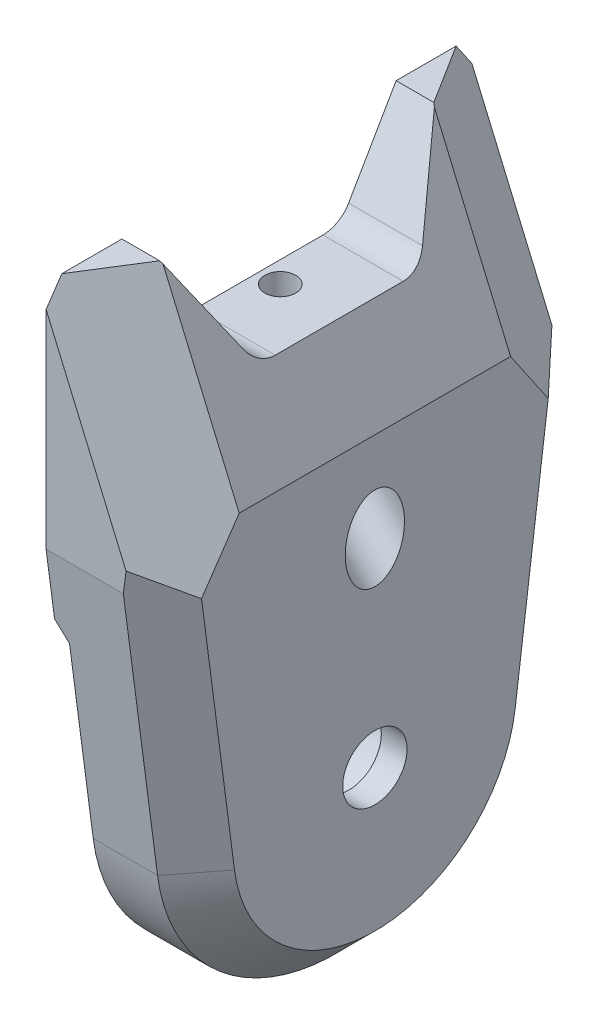
from build123d import *

# Parameters (mm, degrees)
BOSS_EXTRUDE4_DEPTH  = 4.5
SKETCH1_R            = 2.25
BOSS_EXTRUDE1_DEPTH  = 4
SKETCH1_4_R          = 2.25
SKETCH1_4_R_2        = 1.25
BOSS_EXTRUDE2_DEPTH  = 1
CHAMFER1_SIZE        = 3
CHAMFER1_SIZE_2      = 5.196152423
FILLET1_R            = 1.15
CHAMFER2_SIZE        = 7
CHAMFER2_SIZE2       = 3
CHAMFER3_SIZE        = 3
CHAMFER3_SIZE2       = 1.732050808
CHAMFER4_SIZE        = 1.5
CUT_EXTRUDE1_START   = -2
SKETCH1_6_R          = 1.05
CUT_EXTRUDE1_DEPTH   = 19.48660355
CUT_SWEEP1_PROFILE_R = 0.6
CUT_SWEEP2_PROFILE_R = 1.15
CHAMFER5_SIZE        = 0.5


# Some blends are built 0.0001 mm under size
with BuildPart() as part:
    # Sketch1<7> → Boss-Extrude4 (new body)
    with BuildSketch(Plane(origin=(0, 0, 0), x_dir=(0, 0, -1), z_dir=(1, 0, 0))):
        with BuildLine():
            Line((8.27, 9.234757272), (8.27, 18.195))
            Line((8.27, 18.195), (2.325, 18.195))
            Line((2.325, 18.195), (2.325, 14.425))
            Line((2.325, 14.425), (-2.325, 14.425))
            Line((-2.325, 14.425), (-2.325, 18.195))
            Line((-2.325, 18.195), (-8.27, 18.195))
            Line((-8.27, 18.195), (-8.27, 9.234757272))
            Line((-8.27, 9.234757272), (-7.859471067, 6.101983066))
            Line((-7.859471067, 6.101983066), (-5.358442733, 4.658013684))
            ThreePointArc((-5.358442733, 4.658013684), (0, 7.1), (5.358442733, 4.658013684))
            Line((5.358442733, 4.658013684), (7.859471067, 6.101983066))
            Line((7.859471067, 6.101983066), (8.27, 9.234757272))
        make_face()
    extrude(amount=-BOSS_EXTRUDE4_DEPTH)

    # Sketch1 → Boss-Extrude1 (add)
    with BuildSketch(Plane(origin=(0, 0, 0), x_dir=(0, 0, -1), z_dir=(1, 0, 0))):
        with BuildLine():
            Line((6.940659998, -0.909526687), (7.859471067, 6.101983066))
            Line((7.859471067, 6.101983066), (5.358442733, 4.658013684))
            ThreePointArc((5.358442733, 4.658013684), (0, 7.1), (-5.358442733, 4.658013684))
            Line((-5.358442733, 4.658013684), (-7.859471067, 6.101983066))
            Line((-7.859471067, 6.101983066), (-6.940659998, -0.909526687))
            ThreePointArc((-6.940659998, -0.909526687), (0, -7), (6.940659998, -0.909526687))
        make_face()
        Circle(SKETCH1_R, mode=Mode.SUBTRACT)
    extrude(amount=-BOSS_EXTRUDE1_DEPTH)

    # Sketch1<4> → Boss-Extrude2 (add)
    with BuildSketch(Plane(origin=(0, 0, 0), x_dir=(0, 0, -1), z_dir=(1, 0, 0))):
        Circle(SKETCH1_4_R)
        Circle(SKETCH1_4_R_2, mode=Mode.SUBTRACT)
    extrude(amount=-BOSS_EXTRUDE2_DEPTH)

    # Chamfer1
    # the kernel refuses this chamfer: 5.196152423, 3 mm, written as the material it takes off along each edge
    with BuildSketch(Plane(origin=(13.442891912, 18.195, -2.325), x_dir=(0, 0.057893862402672046, -0.9983227437537926), z_dir=(-1, 0, 0))) as chamfer1_piece_1_section:
        Polygon((CHAMFER1_SIZE * 0.998322743754, CHAMFER1_SIZE * 0.0578938624027), (-CHAMFER1_SIZE_2 * 0.0578938623994, CHAMFER1_SIZE_2 * 0.998322743697), (0, 0), align=None)
    chamfer1_piece_1 = extrude(amount=31.385783824, mode=Mode.PRIVATE)
    chamfer1_piece_1 = split(chamfer1_piece_1, bisect_by=Plane(origin=(-2.25, 14.425, -3.37149022), z_dir=(0, 1, 0)), keep=Keep.TOP, mode=Mode.PRIVATE)
    add(chamfer1_piece_1, mode=Mode.SUBTRACT)
    with BuildSketch(Plane(origin=(13.442891912, 18.195, 2.325), x_dir=(0, -0.9998132206222079, -0.019326765612700594), z_dir=(-1, 0, 0))) as chamfer1_piece_2_section:
        Polygon((CHAMFER1_SIZE_2 * 0.999813220566, CHAMFER1_SIZE_2 * 0.0193267656116), (-CHAMFER1_SIZE * 0.0193267656127, CHAMFER1_SIZE * 0.999813220622), (0, 0), align=None)
    chamfer1_piece_2 = extrude(amount=31.385783824, mode=Mode.PRIVATE)
    chamfer1_piece_2 = split(chamfer1_piece_2, bisect_by=Plane(origin=(-2.25, 14.425, 3.37149022), z_dir=(0, 1, 0)), keep=Keep.TOP, mode=Mode.PRIVATE)
    add(chamfer1_piece_2, mode=Mode.SUBTRACT)

    # Fillet1
    fillet1_edges = [part.edges().sort_by_distance(p)[0] for p in [
        (-2.25, 14.425, -3.148389485),
        (-2.25, 14.425, 3.148389485),
    ]]
    fillet(fillet1_edges, radius=FILLET1_R)

    # Chamfer2
    chamfer2_edges = [part.edges().sort_by_distance(p)[0] for p in [
        (0, 18.195, 6.7975),
    ]]
    chamfer2_side = [part.faces().sort_by_distance(p)[0] for p in [
        (0, 5.909970068, 0),
    ]]
    chamfer(chamfer2_edges, length=CHAMFER2_SIZE, length2=CHAMFER2_SIZE2, reference=chamfer2_side[0])

    # Chamfer3
    chamfer3_edges = [part.edges().sort_by_distance(p)[0] for p in [
        (-1.5, 14.695, -8.27),
        (-1.5, 14.695, 8.27),
    ]]
    chamfer3_side = [part.faces().sort_by_distance(p)[0] for p in [
        (-1.210290333, 14.019010778, 0),
    ]]
    chamfer(chamfer3_edges, length=CHAMFER3_SIZE, length2=CHAMFER3_SIZE2, reference=chamfer3_side[0])

    # Chamfer4
    chamfer4_edges = [part.edges().sort_by_distance(p)[0] for p in [
        (0, 3.140553901, 7.471395746),
        (0, 3.140553901, -7.471395746),
        (0, -7, 0),
    ]]
    chamfer(chamfer4_edges, length=CHAMFER4_SIZE)

    # Sketch1<6> → Cut-Extrude1 (cut, through all)
    with BuildSketch(Plane(origin=(0, 0, 0), x_dir=(0, 0, -1), z_dir=(1, 0, 0)).offset(CUT_EXTRUDE1_START)):
        with Locations((6.25, 11.925)):
            Circle(SKETCH1_6_R)
        with Locations((-6.25, 11.925)):
            Circle(SKETCH1_6_R)
    extrude(amount=-CUT_EXTRUDE1_DEPTH, mode=Mode.SUBTRACT)

    # Cut-Sweep1: sweep along a path in Sketch2
    with BuildLine(Plane.XY) as cut_sweep1_path:
        Line((4.128300859, 3.586165235), (-2.942766953, 10.657233047))
        ThreePointArc((-2.942766953, 10.657233047), (-3.484698831, 11.468291419), (-3.675, 12.425))
        Line((-3.675, 12.425), (-3.675, 14.425))
    # Cut-Sweep1 profile (on start of the path) → Cut-Sweep1 (sweep, cut)
    with BuildSketch(Plane(origin=(4.128300859, 3.586165235, 0), x_dir=(-0.7071067811865461, -0.707106781186549, 0), z_dir=(-0.707106781186549, 0.7071067811865461, 0))):
        Circle(CUT_SWEEP1_PROFILE_R)
    sweep(path=cut_sweep1_path.line, mode=Mode.SUBTRACT)

    # Cut-Sweep2: sweep along a path in Sketch2<3>
    with BuildLine(Plane.XY) as cut_sweep2_path:
        Line((-2.942766953, 10.657233047), (4.128300859, 3.586165235))
    # Cut-Sweep2 profile (on start of the path) → Cut-Sweep2 (sweep, cut)
    with BuildSketch(Plane(origin=(-2.942766953, 10.657233047, 0), x_dir=(0.7071067811865461, 0.707106781186549, 0), z_dir=(0.707106781186549, -0.7071067811865461, 0))):
        Circle(CUT_SWEEP2_PROFILE_R)
    sweep(path=cut_sweep2_path.line, mode=Mode.SUBTRACT)

    # Chamfer5
    chamfer5_edges = [part.edges().sort_by_distance(p)[0] for p in [
        (-4.5, 5.379998375, -6.6089569),
        (-4.5, 7.1, 0),
        (-4.5, 5.379998375, 6.6089569),
    ]]
    chamfer(chamfer5_edges, length=CHAMFER5_SIZE - 0.0001)  # a hair under: the kernel refuses the full size


solid = part.part
